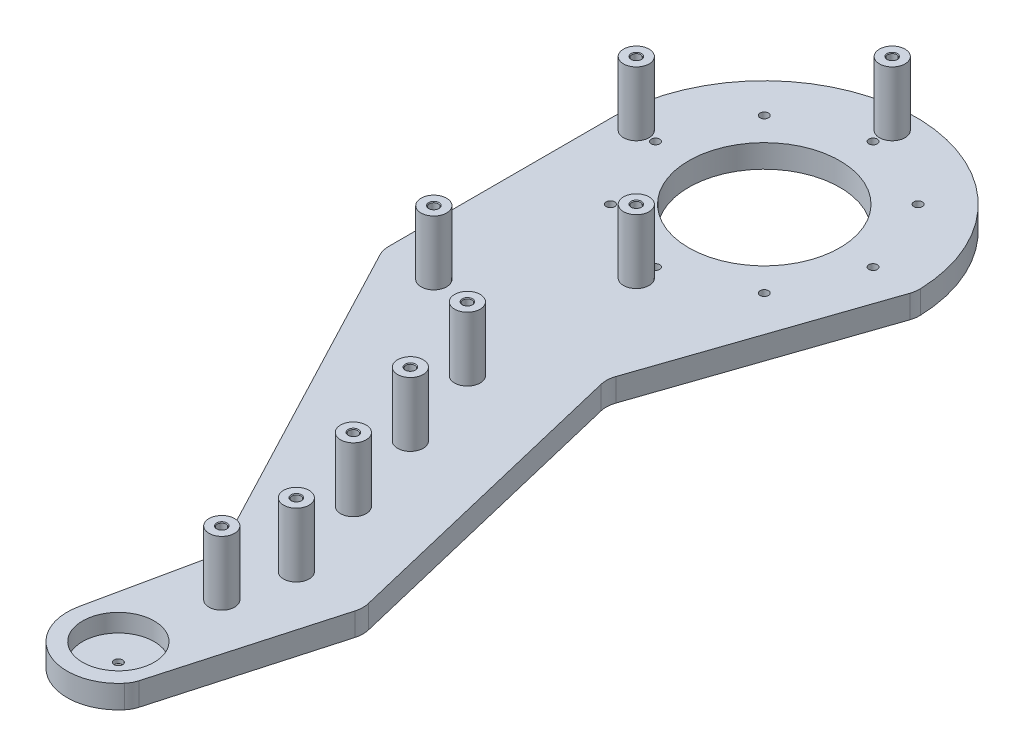
from build123d import *

# Parameters (mm, degrees)
EXTRUDE_1_DEPTH              = 5
EXTRUDE_1_DEPTH_BACK         = 2
FILLET_1_R                   = 10
EXTRUDE_2_DEPTH              = 2
SKETCH_7_R                   = 5
EXTRUDE_4_DEPTH              = 27
SKETCH_9_R                   = 29.5
CUT_EXTRUDE_2_DEPTH          = 199.967077983
SKETCH_6_R                   = 5
EXTRUDE_6_DEPTH              = 27
M4X0_5_1_D                   = 3.5
M4X0_5_1_DEPTH               = 9.5
M4X0_5_1_CSINK_D             = 4.05
M4X0_5_1_CSINK_ANGLE         = 90
M4X0_5_1_TIP                 = 1.051506083
SKETCH_12_R                  = 14
CUT_EXTRUDE_3_DEPTH          = 7
HOLE_WIZARD_M4_1_D           = 3.3
HOLE_WIZARD_M4_1_DEPTH       = 10.1
HOLE_WIZARD_M4_1_CSINK_D     = 4.05
HOLE_WIZARD_M4_1_CSINK_ANGLE = 90
HOLE_WIZARD_M4_1_TIP         = 0.991420021
PATTERN_CIRCULAR_1_COUNT     = 8


# Read off the part's stored shape, not the designer's step: M4 螺纹孔2
with BuildPart() as part:
    # 草图1 → 凸台-拉伸1 (new, two sides: drawn at the far end of the back side and taken through both)
    with BuildSketch(Plane(origin=(0, 0, 0), x_dir=(1, 0, 0), z_dir=(0, 1, 0)).offset(-EXTRUDE_1_DEPTH_BACK)):
        with BuildLine():
            Line((28.36210367, 15.823673932), (59.117479337, 105.823673932))
            ThreePointArc((59.117479337, 105.823673932), (0, 164.941153269), (-59.117479337, 105.823673932))
            Line((-59.117479337, 105.823673932), (-59.117478081, 105.811488283))
            Line((-59.117478081, 105.811488283), (-59.108203667, 15.82367441))
            Line((-59.108203667, 15.82367441), (11.786941507, -119.17632559))
            Line((11.786941507, -119.17632559), (2.233923801, -164.17632559))
            ThreePointArc((2.233923801, -164.17632559), (14.171961552, -186.818592843), (38.601140216, -179.176326068))
            Line((38.601140216, -179.176326068), (58.357719046, -109.176326068))
            Line((58.357719046, -109.176326068), (28.36210367, 15.823673932))
        make_face()
    extrude(amount=EXTRUDE_1_DEPTH + EXTRUDE_1_DEPTH_BACK)

    # 圆角1
    fillet_1_edges = [part.edges().sort_by_distance(p)[0] for p in [
        (11.786941507, 1.5, 119.17632559),
        (-59.108203667, 1.5, -15.82367441),
        (59.117479337, 1.5, -105.823673932),
        (28.36210367, 1.5, -15.823673932),
        (58.357719046, 1.5, 109.176326068),
        (38.601140216, 1.5, 179.176326068),
    ]]
    fillet(fillet_1_edges, radius=FILLET_1_R)

    # 草图8 → 凸台-拉伸2 (add)
    with BuildSketch(Plane(origin=(0, 5, 0), x_dir=(1, 0, 0), z_dir=(0, 1, 0))):
        with BuildLine():
            Line((29.300361737, 18.569315114), (58.554588826, 104.176477469))
            ThreePointArc((58.554588826, 104.176477469), (58.98180751, 105.930695077), (59.086633883, 107.733139709))
            ThreePointArc((59.086633883, 107.733139709), (-0.95485745, 164.933441402), (-59.117479337, 105.823673932))
            Line((-59.117479337, 105.823673932), (-59.108457771, 18.289190078))
            ThreePointArc((-59.108457771, 18.289190078), (-58.817462925, 15.895388783), (-57.961893059, 13.640846069))
            Line((-57.961893059, 13.640846069), (10.108867752, -115.980902881))
            ThreePointArc((10.108867752, -115.980902881), (11.161474402, -119.262675904), (11.037439917, -122.706892851))
            Line((11.037439917, -122.706892851), (2.233923801, -164.17632559))
            ThreePointArc((2.233923801, -164.17632559), (13.031285464, -186.305812614), (37.116640576, -181.187914225))
            ThreePointArc((37.116640576, -181.187914225), (38.296139318, -179.43577869), (39.081319631, -177.47499107))
            Line((39.081319631, -177.47499107), (57.648798745, -111.688118295))
            ThreePointArc((57.648798745, -111.688118295), (58.022811544, -109.169699075), (57.748719119, -106.63845545))
            Line((57.748719119, -106.63845545), (29.039148609, 13.002240988))
            ThreePointArc((29.039148609, 13.002240988), (28.774088822, 15.804343144), (29.300361737, 18.569315114))
        make_face()
    extrude(amount=EXTRUDE_2_DEPTH)

    # 草图7 → 凸台-拉伸4 (add)
    with BuildSketch(Plane(origin=(0, 5, 0), x_dir=(1, 0, 0), z_dir=(0, 1, 0))):
        with Locations(Location((0, -10.167611435, 0), (0, 0, 270))):
            Circle(SKETCH_7_R)
        with Locations(Location((10.962320581, -43.406557379, 0), (0, 0, 270))):
            Circle(SKETCH_7_R)
        with Locations(Location((21.924641163, -76.645503323, 0), (0, 0, 270))):
            Circle(SKETCH_7_R)
        with Locations(Location((32.886961744, -109.884449267, 0), (0, 0, 270))):
            Circle(SKETCH_7_R)
        with Locations(Location((27.862861404, -133.987984293, 0), (0, 0, 270))):
            Circle(SKETCH_7_R)
    extrude(amount=EXTRUDE_4_DEPTH)

    # 草图9 → 切除-拉伸2 (cut, through all)
    with BuildSketch(Plane(origin=(0, 7, 0), x_dir=(1, 0, 0), z_dir=(0, 1, 0))):
        with Locations(Location((0, 105.823673932, 0), (0, 0, 270))):
            Circle(SKETCH_9_R)
    extrude(amount=-CUT_EXTRUDE_2_DEPTH, mode=Mode.SUBTRACT)

    # 草图6 → 凸台-拉伸6 (add)
    with BuildSketch(Plane(origin=(0, 5, 0), x_dir=(1, 0, 0), z_dir=(0, 1, 0))):
        with Locations(Location((0, 155.823673932, 0), (0, 0, 270))):
            Circle(SKETCH_6_R)
        with Locations(Location((0, 55.823673932, 0), (0, 0, 270))):
            Circle(SKETCH_6_R)
        with Locations(Location((-50, 105.823673932, 0), (0, 0, 270))):
            Circle(SKETCH_6_R)
        with Locations(Location((-39.108203667, 15.82367441, 0), (0, 0, 270))):
            Circle(SKETCH_6_R)
    extrude(amount=EXTRUDE_6_DEPTH)

    # M4x0.5 螺纹孔1
    with Locations(Plane(origin=(0, 32, 0), x_dir=(1, 0, 0), z_dir=(0, 1, 0))):
        with Locations((0, 155.823673932), (-50, 105.823673932), (0, 55.823673932), (-39.108203667, 15.82367441), (0, -10.167611435), (10.962320581, -43.406557379), (21.924641163, -76.645503323), (32.886961744, -109.884449267), (27.862861404, -133.987984293)):
            CounterSinkHole(M4X0_5_1_D / 2, M4X0_5_1_CSINK_D / 2, depth=M4X0_5_1_DEPTH, counter_sink_angle=M4X0_5_1_CSINK_ANGLE)
            with Locations((0, 0, -(M4X0_5_1_DEPTH + M4X0_5_1_TIP / 2))):  # 118° drill point
                Cone(0, M4X0_5_1_D / 2, M4X0_5_1_TIP, mode=Mode.SUBTRACT)

    # 草图12 → 切除-拉伸3 (cut)
    with BuildSketch(Plane(origin=(0, 7, 0), x_dir=(1, 0, 0), z_dir=(0, 1, 0))):
        with Locations(Location((21.7979386, -168.329556252, 0), (0, 0, 270))):
            Circle(SKETCH_12_R)
    extrude(amount=-CUT_EXTRUDE_3_DEPTH, mode=Mode.SUBTRACT)

    # M4 螺纹孔1
    with Locations(Plane(origin=(0, -2, 0), x_dir=(-1, 0, 0), z_dir=(0, -1, 0))):
        with Locations((-21.7979386, -168.329556252)):
            CounterSinkHole(HOLE_WIZARD_M4_1_D / 2, HOLE_WIZARD_M4_1_CSINK_D / 2, depth=HOLE_WIZARD_M4_1_DEPTH, counter_sink_angle=HOLE_WIZARD_M4_1_CSINK_ANGLE)
            with Locations((0, 0, -(HOLE_WIZARD_M4_1_DEPTH + HOLE_WIZARD_M4_1_TIP / 2))):  # 118° drill point
                Cone(0, HOLE_WIZARD_M4_1_D / 2, HOLE_WIZARD_M4_1_TIP, mode=Mode.SUBTRACT)

    # M4 螺纹孔2 outline → M4 螺纹孔2 (revolve, cut)
    with BuildSketch(Plane.XY.offset(-148.323673932)):
        Polygon((1.65, -1.625), (1.65, 7), (0, 7), (0, -2), (2.025, -2), align=None)
    hole_wizard_m4_2 = revolve(axis=Axis((0, 0, -148.323673932), (0, 1, 0)), mode=Mode.SUBTRACT)

    # 阵列(圆周)1: M4 螺纹孔2 ×8 about axis
    pattern_circular_1_axis = Axis((0, 0, -105.823673932), (0, 1, 0))
    for i in range(1, PATTERN_CIRCULAR_1_COUNT):
        add(hole_wizard_m4_2.rotate(pattern_circular_1_axis, i * 360 / PATTERN_CIRCULAR_1_COUNT), mode=Mode.SUBTRACT)


solid = part.part
